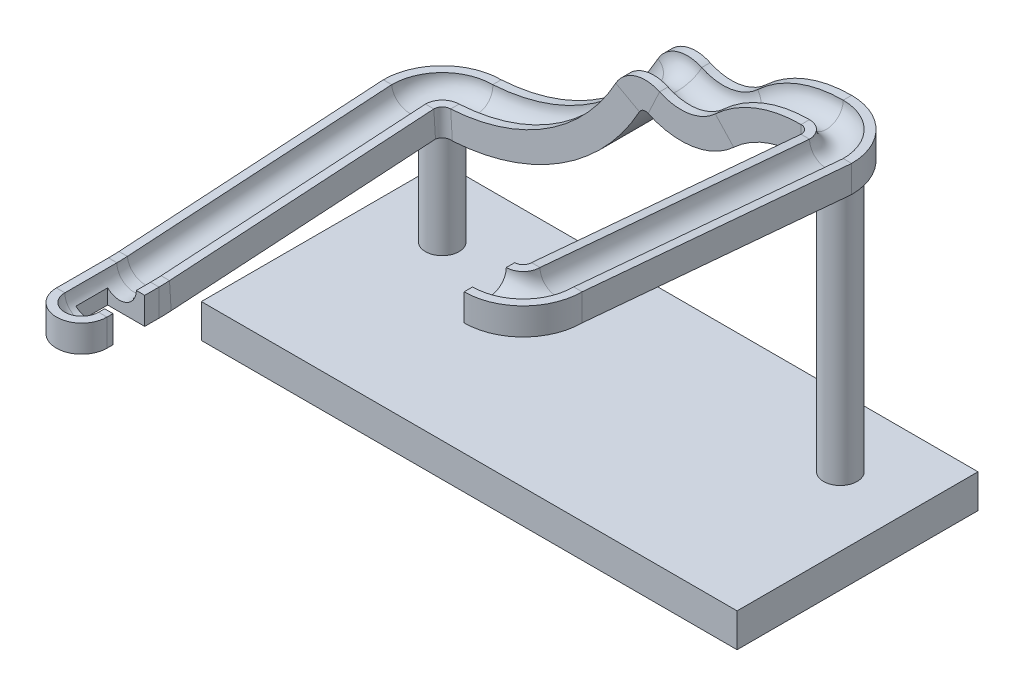
from build123d import *

# Parameters (mm, degrees)
REVOLVE_1_ANGLE     = 180
CUT_EXTRUDE_1_REACH = 179.268
SKETCH_26_W         = 11
SKETCH_26_H         = 9.4
SKETCH_30_W         = 159
SKETCH_30_H         = 71.5
EXTRUDE_3_DEPTH     = 10
EXTRUDE_4_REACH     = 203.503
SKETCH_31_R         = 5


# Read off the part's stored shape, not the designer's step: 旋轉1
with BuildPart() as part:
    # 掃出1: sweep along a path in 草圖1
    with BuildLine(Plane(origin=(0, 0, 0), x_dir=(0, 0, -1), z_dir=(1, 0, 0))) as sweep_1_path:
        Line((0, 0), (80, -6.999093082))
    # 草圖8 → 掃出1 (sweep)
    with BuildSketch(Plane.XY):
        with BuildLine():
            Line((5, 0), (7.5, 0))
            Line((7.5, 0), (7.5, -8))
            Line((7.5, -8), (-7.5, -8))
            Line((-7.5, -8), (-7.5, 0))
            Line((-7.5, 0), (-5, 0))
            ThreePointArc((-5, 0), (0, -5), (5, 0))
        make_face()
    sweep(path=sweep_1_path.line)

    # 掃出2: sweep along a path in 草圖3
    with BuildLine(Plane(origin=(0, -6.999093082, 0), x_dir=(1, 0, 0), z_dir=(0, 1, 0))) as sweep_2_path:
        ThreePointArc((0, 80), (-2.928932188, 87.071067812), (-10, 90))
    # 草圖15 → 掃出2 (sweep)
    with BuildSketch(Plane(origin=(0, 0, -80), x_dir=(-1, 0, 0), z_dir=(0, 0, -1))):
        with BuildLine():
            Line((7.5, -14.999093082), (7.5, -6.999093082))
            Line((7.5, -6.999093082), (5, -6.999093082))
            ThreePointArc((5, -6.999093082), (0, -11.999093082), (-5, -6.999093082))
            Line((-5, -6.999093082), (-7.5, -6.999093082))
            Line((-7.5, -6.999093082), (-7.5, -14.999093082))
            Line((-7.5, -14.999093082), (7.5, -14.999093082))
        make_face()
    sweep(path=sweep_2_path.line)

    # 掃出6: sweep along a path in 草圖4
    with BuildLine(Plane.XY.offset(-90)) as sweep_6_path:
        ThreePointArc((-114, -55), (-85.48557321, -45.758350859), (-65, -23.876351309))
        ThreePointArc((-65, -23.876351309), (-59.344635199, -19.169851161), (-52, -19.606461369))
        ThreePointArc((-52, -19.606461369), (-43.328947167, -20.827564341), (-35.453602253, -16.999093082))
        ThreePointArc((-35.453602253, -16.999093082), (-23.673751019, -9.588764492), (-10, -6.999093082))
    # 草圖19 → 掃出6 (sweep)
    with BuildSketch(Plane.ZY.offset(10)):
        with BuildLine():
            Line((-97.5, -14.999093082), (-82.5, -14.999093082))
            Line((-82.5, -14.999093082), (-82.5, -6.999093082))
            Line((-82.5, -6.999093082), (-85, -6.999093082))
            ThreePointArc((-85, -6.999093082), (-90, -11.999093082), (-95, -6.999093082))
            Line((-95, -6.999093082), (-97.5, -6.999093082))
            Line((-97.5, -6.999093082), (-97.5, -14.999093082))
        make_face()
    sweep(path=sweep_6_path.line)

    # 掃出7: sweep along a path in 草圖5
    with BuildLine(Plane(origin=(0, -55, 0), x_dir=(1, 0, 0), z_dir=(0, 1, 0))) as sweep_7_path:
        ThreePointArc((-114, 90), (-121.071067812, 87.071067812), (-124, 80))
    # 草圖20 → 掃出7 (sweep)
    with BuildSketch(Plane(origin=(-116.921360423, -7.136292944, 0), x_dir=(0, 0, 1), z_dir=(-0.9981425535898466, -0.06092161121589024, 0))):
        with BuildLine():
            Line((-97.5, -47.952776769), (-97.5, -55.952776769))
            Line((-97.5, -55.952776769), (-82.5, -55.952776769))
            Line((-82.5, -55.952776769), (-82.5, -47.952776769))
            Line((-82.5, -47.952776769), (-85, -47.952776769))
            ThreePointArc((-85, -47.952776769), (-90, -52.952776769), (-95, -47.952776769))
            Line((-95, -47.952776769), (-97.5, -47.952776769))
        make_face()
    sweep(path=sweep_7_path.line)

    # 掃出8: sweep along a path in 草圖6
    with BuildLine(Plane(origin=(-124, 0, 0), x_dir=(0, 0, -1), z_dir=(1, 0, 0))) as sweep_8_path:
        Line((80, -55), (1.557937214, -59.902628924))
        ThreePointArc((1.557937214, -59.902628924), (-0.000760155, -59.975651302), (-1.560977094, -60))
        Line((-1.560977094, -60), (-17, -60))
    # 草圖21 → 掃出8 (sweep)
    with BuildSketch(Plane(origin=(0, 4.660546858, -76.358619691), x_dir=(1, 0, 0), z_dir=(0, -0.06092161121589024, 0.9981425535898466))):
        with BuildLine():
            Line((-129, -59.771569345), (-131.5, -59.771569345))
            Line((-131.5, -59.771569345), (-131.5, -67.771569345))
            Line((-131.5, -67.771569345), (-116.5, -67.771569345))
            Line((-116.5, -67.771569345), (-116.5, -59.771569345))
            Line((-116.5, -59.771569345), (-119, -59.771569345))
            ThreePointArc((-119, -59.771569345), (-124, -64.771569345), (-129, -59.771569345))
        make_face()
    sweep(path=sweep_8_path.line)

    # 掃出9: sweep along a path in 草圖22
    with BuildLine(Plane(origin=(0, 0, 0), x_dir=(1, 0, 0), z_dir=(0, 1, 0))) as sweep_9_path:
        ThreePointArc((0, 0), (-2.928932188, -7.071067812), (-10, -10))
    # 草圖23 → 掃出9 (sweep)
    with BuildSketch(Plane.XY):
        with BuildLine():
            Line((-7.5, 0), (-7.5, -8))
            Line((-7.5, -8), (7.5, -8))
            Line((7.5, -8), (7.5, 0))
            Line((7.5, 0), (5, 0))
            ThreePointArc((5, 0), (0, -5), (-5, 0))
            Line((-5, 0), (-7.5, 0))
        make_face()
    sweep(path=sweep_9_path.line)

    # 旋轉1 outline → 旋轉1 (revolve)
    with BuildSketch(Plane(origin=(-124, 0.024682835, 16.912396843), x_dir=(-1, 0, 0), z_dir=(1.4532479245137334e-14, -0.0014594506721384598, -0.9999989350013008))):
        with BuildLine():
            Line((7.5, -68.024746762), (7.5, -60.024746762))
            Line((7.5, -60.024746762), (5, -60.024746762))
            ThreePointArc((5, -60.024746762), (3.535533906, -63.560280668), (0, -65.024746762))
            Line((0, -65.024746762), (0, -68.024746762))
            Line((0, -68.024746762), (7.5, -68.024746762))
        make_face()
    revolve(axis=Axis((-124, 0.024682835, 16.912396843), (0, 0.9999989350013008, -0.0014594506721384598)), revolution_arc=REVOLVE_1_ANGLE)

    # 草圖26 → 除料-伸長1 (cut, up to next)
    with BuildSketch(Plane(origin=(0, 0, 0), x_dir=(1, 0, 0), z_dir=(0, 1, 0)), mode=Mode.PRIVATE) as cut_extrude_1_sk1:
        with Locations((-122, -10.5)):
            Rectangle(SKETCH_26_W, SKETCH_26_H)
    cut_extrude_1_tool1 = extrude(cut_extrude_1_sk1.sketch, amount=-CUT_EXTRUDE_1_REACH, mode=Mode.PRIVATE) & part.part
    add(cut_extrude_1_tool1.solids().sort_by_distance((-122, 0, 10.5))[0], mode=Mode.SUBTRACT)

    # 草圖31 → 填料-伸長4 (add, up to next)
    with BuildSketch(Plane(origin=(0, -95, 0), x_dir=(1, 0, 0), z_dir=(0, 1, 0)), mode=Mode.PRIVATE) as extrude_4_sk1:
        with Locations(Location((-121.071067812, 87.071067812, 0), (0, 0, 90))):
            Circle(SKETCH_31_R)
    extrude_4_tool1 = extrude(extrude_4_sk1.sketch, amount=EXTRUDE_4_REACH, mode=Mode.PRIVATE) - part.part
    # 草圖31 → 填料-伸長4 (add, up to next)
    with BuildSketch(Plane(origin=(0, -95, 0), x_dir=(1, 0, 0), z_dir=(0, 1, 0)), mode=Mode.PRIVATE) as extrude_4_sk2:
        with Locations(Location((-2.928932188, 87.071067812, 0), (0, 0, 90))):
            Circle(SKETCH_31_R)
    extrude_4_tool2 = extrude(extrude_4_sk2.sketch, amount=EXTRUDE_4_REACH, mode=Mode.PRIVATE) - part.part


with BuildPart() as body_2:
    # 草圖30 → 填料-伸長3 (new body)
    with BuildSketch(Plane(origin=(0, -105, 0), x_dir=(-1, 0, 0), z_dir=(0, -1, 0))):
        with Locations((62, 71.75)):
            Rectangle(SKETCH_30_W, SKETCH_30_H)
    extrude(amount=-EXTRUDE_3_DEPTH)


with BuildPart() as part_1:
    add(part.part)

    add(body_2.part)  # 填料-伸長4 merges body 2
    add(extrude_4_tool1.solids().sort_by_distance((-121.071068, -95, -87.071068))[0])
    add(extrude_4_tool2.solids().sort_by_distance((-2.928932, -95, -87.071068))[0])


solid = part_1.part
